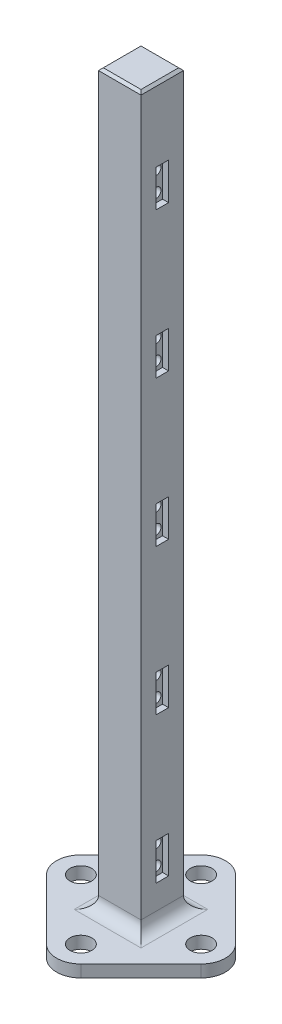
from build123d import *

# Parameters (mm, degrees)
SKETCH1_R             = 4.5
BOSS_EXTRUDE1_DEPTH   = 2.5
SKETCH2_W             = 17.5
SKETCH2_H             = 17.5
BOSS_EXTRUDE2_DEPTH   = 300
SKETCH3_W             = 5.2
SKETCH3_H             = 15.2
CUT_EXTRUDE1_DEPTH    = 2.5
F_4_0MM_DOWEL_HOLE1_D = 4
LPATTERN1_COUNT       = 5
LPATTERN1_PITCH       = 60
CHAMFER1_SIZE         = 1
FILLET1_R             = 5


with BuildPart() as part:
    # Sketch1 → Boss-Extrude1 (new, symmetric)
    with BuildSketch(Plane(origin=(0, 0, 0), x_dir=(1, 0, 0), z_dir=(0, 1, 0))):
        with BuildLine():
            Line((-31.821067812, 7.071067812), (-7.071067812, 31.821067812))
            ThreePointArc((-7.071067812, 31.821067812), (0, 34.75), (7.071067812, 31.821067812))
            Line((7.071067812, 31.821067812), (31.821067812, 7.071067812))
            ThreePointArc((31.821067812, 7.071067812), (34.75, 0), (31.821067812, -7.071067812))
            Line((31.821067812, -7.071067812), (7.071067812, -31.821067812))
            ThreePointArc((7.071067812, -31.821067812), (0, -34.75), (-7.071067812, -31.821067812))
            Line((-7.071067812, -31.821067812), (-31.821067812, -7.071067812))
            ThreePointArc((-31.821067812, -7.071067812), (-34.75, 0), (-31.821067812, 7.071067812))
        make_face()
        with Locations((0, 24.75)):
            Circle(SKETCH1_R, mode=Mode.SUBTRACT)
        with Locations((24.75, 0)):
            Circle(SKETCH1_R, mode=Mode.SUBTRACT)
        with Locations((0, -24.75)):
            Circle(SKETCH1_R, mode=Mode.SUBTRACT)
        with Locations((-24.75, 0)):
            Circle(SKETCH1_R, mode=Mode.SUBTRACT)
    extrude(amount=BOSS_EXTRUDE1_DEPTH, both=True)

    # Sketch2 → Boss-Extrude2 (add)
    with BuildSketch(Plane(origin=(0, 2.5, 0), x_dir=(1, 0, 0), z_dir=(0, 1, 0))):
        Rectangle(SKETCH2_W, SKETCH2_H)
    extrude(amount=BOSS_EXTRUDE2_DEPTH)

    # Sketch3 → Cut-Extrude1 (cut)
    with BuildSketch(Plane(origin=(8.75, 0, 0), x_dir=(0, 0, -1), z_dir=(1, 0, 0))):
        with Locations((0, 25.1)):
            Rectangle(SKETCH3_W, SKETCH3_H)
    cut_extrude1 = extrude(amount=-CUT_EXTRUDE1_DEPTH, mode=Mode.SUBTRACT)

    # Ø4.0mm Dowel Hole1 (through all)
    with Locations(Plane(origin=(6.25, 0, 0), x_dir=(0, 0, -1), z_dir=(1, 0, 0))):
        with Locations((0, 21), (0, 29.2)):
            f_4_0mm_dowel_hole1 = Hole(F_4_0MM_DOWEL_HOLE1_D / 2)

    # LPattern1: Cut-Extrude1, Ø4.0mm Dowel Hole1 ×5
    with Locations(*[(0, i * LPATTERN1_PITCH, 0) for i in range(1, LPATTERN1_COUNT)]):
        add(cut_extrude1, mode=Mode.SUBTRACT)
        add(f_4_0mm_dowel_hole1, mode=Mode.SUBTRACT)

    # Chamfer1
    chamfer1_edges = [part.edges().sort_by_distance(p)[0] for p in [
        (0, 302.5, -8.75),
        (8.75, 302.5, 0),
        (0, 302.5, 8.75),
        (-8.75, 302.5, 0),
    ]]
    chamfer(chamfer1_edges, length=CHAMFER1_SIZE)

    # Fillet1
    fillet1_edges = [part.edges().sort_by_distance(p)[0] for p in [
        (0, 2.5, -8.75),
        (8.75, 2.5, 0),
        (0, 2.5, 8.75),
        (-8.75, 2.5, 0),
    ]]
    fillet(fillet1_edges, radius=FILLET1_R)


solid = part.part
